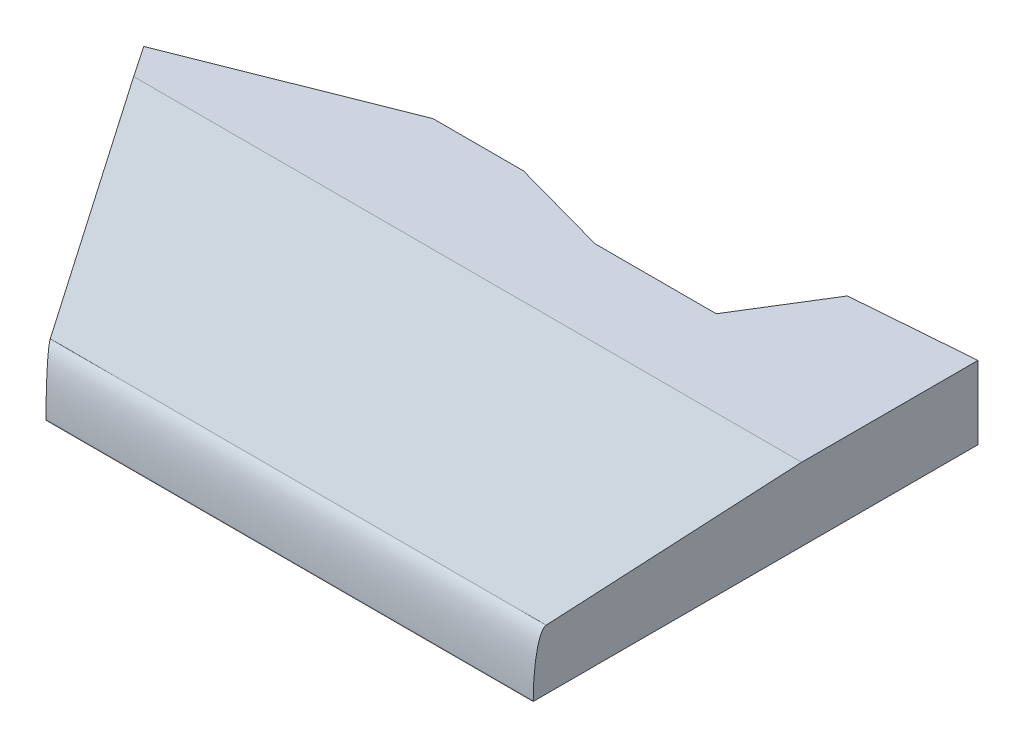
from build123d import *

# Parameters (mm, degrees)
BOSS_EXTRUDE1_DEPTH       = 13.6
BOSS_EXTRUDE2_DEPTH       = 13.6
CHAMFER1_SIZE             = 50
CHAMFER1_SIZE2            = 2.620388964
F_3_0MM_DOWEL_HOLE1_D     = 3.2
F_3_0MM_DOWEL_HOLE1_DEPTH = 1.2
F_3_0MM_DOWEL_HOLE2_D     = 3.2
F_3_0MM_DOWEL_HOLE2_DEPTH = 1.2
F_3_0MM_DOWEL_HOLE3_D     = 3.2
F_3_0MM_DOWEL_HOLE3_DEPTH = 1.2


with BuildPart() as part:
    # wrist → Boss-Extrude1 (new body)
    with BuildSketch(Plane(origin=(0, 0, 0), x_dir=(1, 0, 0), z_dir=(0, 1, 0))):
        Polygon((165.988080985, -4.817824349), (165.988080985, 22.235679058), (143.430369308, 20.475150048), (134.081949487, 5.381860359), (111.510829699, 5.381860359), (93.059430407, 10.480109343), (76.207852469, 10.480109343), (37.653795388, -4.817824349), align=None)
    extrude(amount=BOSS_EXTRUDE1_DEPTH)

    # wrist<5> → Boss-Extrude2 (add)
    with BuildSketch(Plane(origin=(0, 0, 0), x_dir=(1, 0, 0), z_dir=(0, 1, 0))):
        Polygon((165.988080985, -60.618139641), (165.988080985, -4.817824349), (37.653795388, -4.817824349), (75.231684079, -60.618139641), align=None)
    extrude(amount=BOSS_EXTRUDE2_DEPTH)

    # Chamfer1
    chamfer1_edges = [part.edges().sort_by_distance(p)[0] for p in [
        (120.609882532, 13.6, 60.618139641),
    ]]
    chamfer1_side = [part.faces().sort_by_distance(p)[0] for p in [
        (112.052751193, 13.6, 23.244648168),
    ]]
    chamfer(chamfer1_edges, length=CHAMFER1_SIZE, length2=CHAMFER1_SIZE2, reference=chamfer1_side[0])

    # Fillet1
    # an asymmetric fillet: 11, 3 mm, written as the material it takes off along each edge
    with BuildSketch(Plane(origin=(48.087002909, 10.979611036, 60.618139641), x_dir=(0, 0.05233595624294356, -0.9986295347545739), z_dir=(1, 0, 0))) as fillet1_piece_1:
        with BuildLine():
            Bezier((2.427631466, 0), (0, 0), (-0.568257138, -10.842992131), weights=[1, 0.725374371, 1])
            Line((-0.568257138, -10.842992131), (0, 0))
            Line((0, 0), (2.427631466, 0))
        make_face()
    extrude(amount=145.045759247, mode=Mode.SUBTRACT)

    # Ø3.0mm Dowel Hole1
    with Locations(Plane(origin=(-0.719959147, 0, -9.224858415), x_dir=(-0.9969682889311796, 0, 0.07780893821172487), z_dir=(-0.07780893821172487, 0, -0.9969682889311796))):
        with Locations((-155.901833608, 6.8)):
            Hole(F_3_0MM_DOWEL_HOLE1_D / 2, depth=F_3_0MM_DOWEL_HOLE1_DEPTH)

    # Ø3.0mm Dowel Hole2
    with Locations(Plane(origin=(0, 0, -5.381860359), x_dir=(-1, 0, 0), z_dir=(0, 0, -1))):
        with Locations((-122.796389593, 6.8)):
            Hole(F_3_0MM_DOWEL_HOLE2_D / 2, depth=F_3_0MM_DOWEL_HOLE2_DEPTH)

    # Ø3.0mm Dowel Hole3
    with Locations(Plane(origin=(0, 0, -10.480109343), x_dir=(-1, 0, 0), z_dir=(0, 0, -1))):
        with Locations((-84.633641438, 6.8)):
            Hole(F_3_0MM_DOWEL_HOLE3_D / 2, depth=F_3_0MM_DOWEL_HOLE3_DEPTH)


solid = part.part
